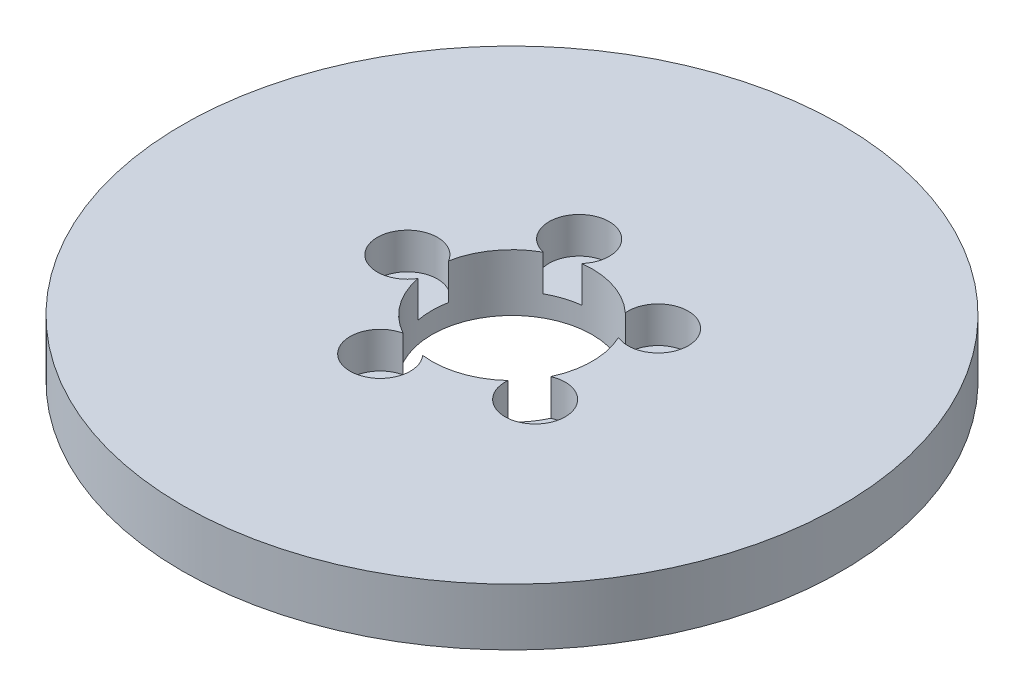
from build123d import *

# Parameters (mm, degrees)
SKETCH1_R           = 92.5
BOSS_EXTRUDE1_DEPTH = 16
SKETCH2_R           = 22.5
CUT_EXTRUDE1_DEPTH  = 132.789605053
SKETCH3_R           = 8.447701715
CUT_EXTRUDE2_DEPTH  = 10.132246098
CIRPATTERN1_COUNT   = 5


with BuildPart() as part:
    # Sketch1 → Boss-Extrude1 (new body)
    with BuildSketch(Plane(origin=(0, 0, 0), x_dir=(1, 0, 0), z_dir=(0, 1, 0))):
        Circle(SKETCH1_R)
    extrude(amount=BOSS_EXTRUDE1_DEPTH)

    # Sketch2 → Cut-Extrude1 (cut, through all)
    with BuildSketch(Plane(origin=(0, 0, 0), x_dir=(1, 0, 0), z_dir=(0, 1, 0))):
        Circle(SKETCH2_R)
    extrude(amount=CUT_EXTRUDE1_DEPTH, mode=Mode.SUBTRACT)

    # Sketch3 → Cut-Extrude2 (cut)
    with BuildSketch(Plane(origin=(0, 16, 0), x_dir=(1, 0, 0), z_dir=(0, 1, 0))):
        with Locations((-29.359454922, 0)):
            Circle(SKETCH3_R)
    cut_extrude2 = extrude(amount=-CUT_EXTRUDE2_DEPTH, mode=Mode.SUBTRACT)

    # CirPattern1: Cut-Extrude2 ×5 about axis
    cirpattern1_axis = Axis((0, 0, 0), (0, 1, 0))
    for i in range(1, CIRPATTERN1_COUNT):
        add(cut_extrude2.rotate(cirpattern1_axis, i * 360 / CIRPATTERN1_COUNT), mode=Mode.SUBTRACT)


solid = part.part
